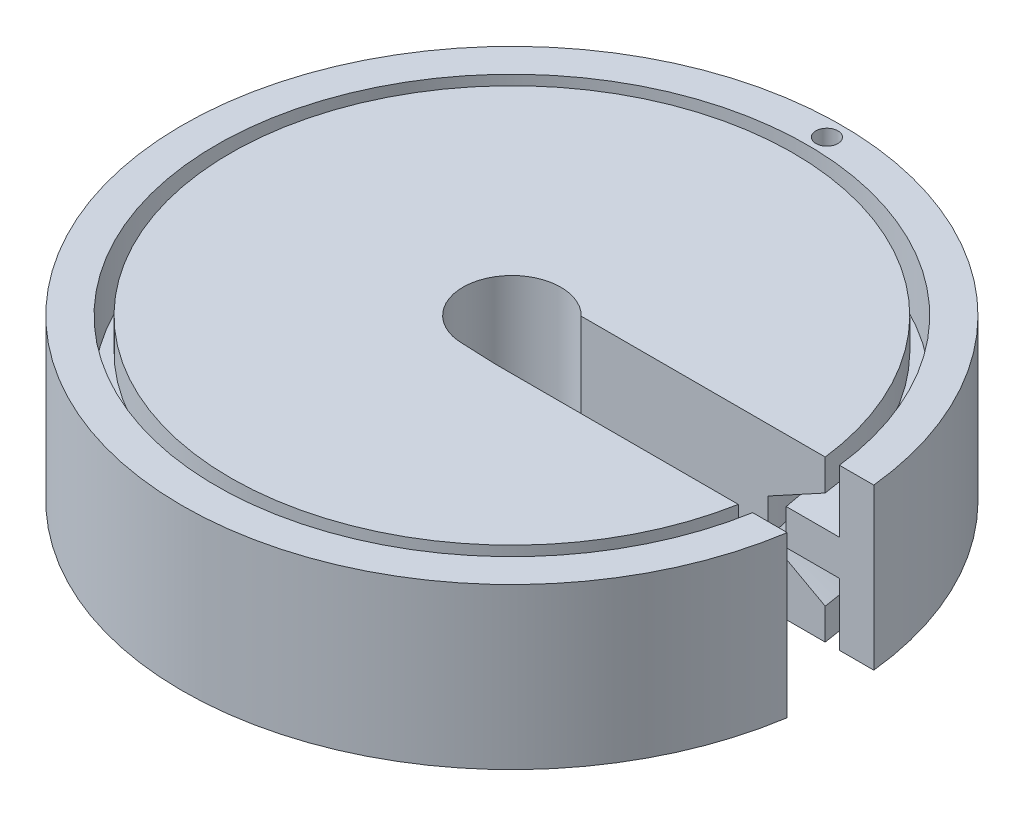
from build123d import *

# Parameters (mm, degrees)
SKETCH_1_R          = 6.318183566
SKETCH_1_R_2        = 2.25
EXTRUDE_1_DEPTH     = 0.7
SKETCH_3_R          = 5.046021061
EXTRUDE_2_DEPTH     = 0.8
SKETCH_4_R          = 6.318183566
SKETCH_5_R          = 6.318183566
EXTRUDE_3_DEPTH     = 0.7
SKETCH_6_R          = 1.1
CUT_EXTRUDE_1_DEPTH = 10.394088018
SKETCH_7_R          = 7.401501987
SKETCH_7_R_2        = 6.64605104
EXTRUDE_4_DEPTH     = 0.7
SKETCH_14_R         = 7.401501987
SKETCH_14_R_2       = 5.45
EXTRUDE_5_DEPTH     = 0.8
SKETCH_31_R         = 7.401501987
SKETCH_31_R_2       = 6.635
EXTRUDE_9_DEPTH     = 3.6
SKETCH_34_W         = 7.257495065
SKETCH_34_H         = 1.896430871
CUT_EXTRUDE_4_DEPTH = 12.069076896
CUT_EXTRUDE_5_DEPTH = 11.861605007
CUT_EXTRUDE_7_DEPTH = 5
SKETCH_38_R         = 0.247262234
CUT_EXTRUDE_9_DEPTH = 5


# Read off the part's stored shape, not the designer's step: 疊層拉伸1
with BuildPart() as part:
    # 草圖1 → 填料-伸長1 (new body)
    with BuildSketch(Plane(origin=(0, 0, 0), x_dir=(1, 0, 0), z_dir=(0, 1, 0))):
        with Locations(Location((0, 0, 0), (0, 0, 270))):
            Circle(SKETCH_1_R)
        with Locations(Location((0, 0, 0), (0, 0, 270))):
            Circle(SKETCH_1_R_2, mode=Mode.SUBTRACT)
    extrude(amount=EXTRUDE_1_DEPTH)

    # 疊層拉伸1 outline → 疊層拉伸1 (revolve)
    with BuildSketch(Plane.XY):
        Polygon((0, 1.4), (0, 0.7), (6.318183566, 0.7), (5.046021061, 1.4), align=None)
    revolve(axis=Axis((0, 0, 0), (0, 1, 0)))

    # 草圖3 → 填料-伸長2 (add)
    with BuildSketch(Plane(origin=(0, 1.4, 0), x_dir=(1, 0, 0), z_dir=(0, 1, 0))):
        with Locations(Location((0, 0, 0), (0, 0, 270))):
            Circle(SKETCH_3_R)
    extrude(amount=EXTRUDE_2_DEPTH)

    # 草圖4 → section 1 of loft_2
    with BuildSketch(Plane(origin=(0, 2.9, 0), x_dir=(1, 0, 0), z_dir=(0, 1, 0)), mode=Mode.PRIVATE) as loft_2_s1:
        Circle(SKETCH_4_R)
    # loft up to a face of the part (loft_2)
    loft([Face(Wire([part.edges().sort_by_distance((3.678391047, 2.2, -3.454239114))[0]])), loft_2_s1.sketch])

    # 草圖5 → 填料-伸長3 (add)
    with BuildSketch(Plane(origin=(0, 2.9, 0), x_dir=(1, 0, 0), z_dir=(0, 1, 0))):
        with Locations(Location((0, 0, 0), (0, 0, 270))):
            Circle(SKETCH_5_R)
    extrude(amount=EXTRUDE_3_DEPTH)

    # 草圖6 → 除料-伸長1 (cut, through all)
    with BuildSketch(Plane.XZ.offset(-0.7)):
        with Locations(Location((0, 0, 0), (0, 0, 270))):
            Circle(SKETCH_6_R)
    extrude(amount=-CUT_EXTRUDE_1_DEPTH, mode=Mode.SUBTRACT)


with BuildPart() as body_2:
    # 草圖7 → 填料-伸長4 (new body)
    with BuildSketch(Plane.XZ):
        with Locations(Location((0, 0, 0), (0, 0, 270))):
            Circle(SKETCH_7_R)
        with Locations(Location((0, 0, 0), (0, 0, 270))):
            Circle(SKETCH_7_R_2, mode=Mode.SUBTRACT)
    extrude(amount=-EXTRUDE_4_DEPTH)



with BuildPart() as body_3:
    # 草圖14 → 填料-伸長5 (new body)
    with BuildSketch(Plane(origin=(0, 1.4, 0), x_dir=(1, 0, 0), z_dir=(0, 1, 0))):
        with Locations(Location((0, 0, 0), (0, 0, 90))):
            Circle(SKETCH_14_R)
        with Locations(Location((0, 0, 0), (0, 0, 270))):
            Circle(SKETCH_14_R_2, mode=Mode.SUBTRACT)
    extrude(amount=EXTRUDE_5_DEPTH)


with BuildPart() as body_2_1:
    add(body_2.part)

    add(body_3.part)  # 填料-伸長9 merges body 3
    # 草圖31 → 填料-伸長9 (add)
    with BuildSketch(Plane(origin=(0, 3.6, 0), x_dir=(1, 0, 0), z_dir=(0, 1, 0))):
        with Locations(Location((0, 0, 0), (0, 0, 90))):
            Circle(SKETCH_31_R)
        with Locations(Location((0, 0, 0), (0, 0, 270))):
            Circle(SKETCH_31_R_2, mode=Mode.SUBTRACT)
    extrude(amount=-EXTRUDE_9_DEPTH)


with BuildPart() as cut_extrude_4_tool:
    # 草圖34 → 除料-伸長4 (new, through all)
    with BuildSketch(Plane(origin=(0, 3.6, 0), x_dir=(1, 0, 0), z_dir=(0, 1, 0))):
        with Locations((4.377250876, -0.183367649)):
            Rectangle(SKETCH_34_W, SKETCH_34_H)
    extrude(amount=-CUT_EXTRUDE_4_DEPTH)


with BuildPart() as part_1:
    add(part.part)

    # 除料-伸長4: cut by cut_extrude_4_tool
    add(cut_extrude_4_tool.part, mode=Mode.SUBTRACT)

    # 草圖35 → 除料-伸長5 (cut, through all)
    with BuildSketch(Plane.XZ.offset(-0.7)):
        Polygon((0.748503344, 1.131583084), (0.46388197, 0.910676659), (0.923529249, 0.707226224), align=None)
    extrude(amount=-CUT_EXTRUDE_5_DEPTH, mode=Mode.SUBTRACT)

    # 草圖36 → 除料-伸長7 (cut, symmetric)
    with BuildSketch(Plane(origin=(0, 1.4, 0), x_dir=(1, 0, 0), z_dir=(0, 1, 0))):
        Polygon((0, -1.1), (0.748503344, -1.131583084), (0.630994706, -0.920173616), align=None)
    extrude(amount=CUT_EXTRUDE_7_DEPTH, both=True, mode=Mode.SUBTRACT)


with BuildPart() as body_2_2:
    add(body_2_1.part)

    # 除料-伸長4: cut by cut_extrude_4_tool
    add(cut_extrude_4_tool.part, mode=Mode.SUBTRACT)

    # 草圖38 → 除料-伸長9 (cut, symmetric)
    with BuildSketch(Plane(origin=(0, 3.6, 0), x_dir=(1, 0, 0), z_dir=(0, 1, 0))):
        with Locations(Location((0.070137897, 7.004124097, 0), (0, 0, 270))):
            Circle(SKETCH_38_R)
    extrude(amount=CUT_EXTRUDE_9_DEPTH, both=True, mode=Mode.SUBTRACT)


solid = Compound([part_1.part, body_2_2.part])
